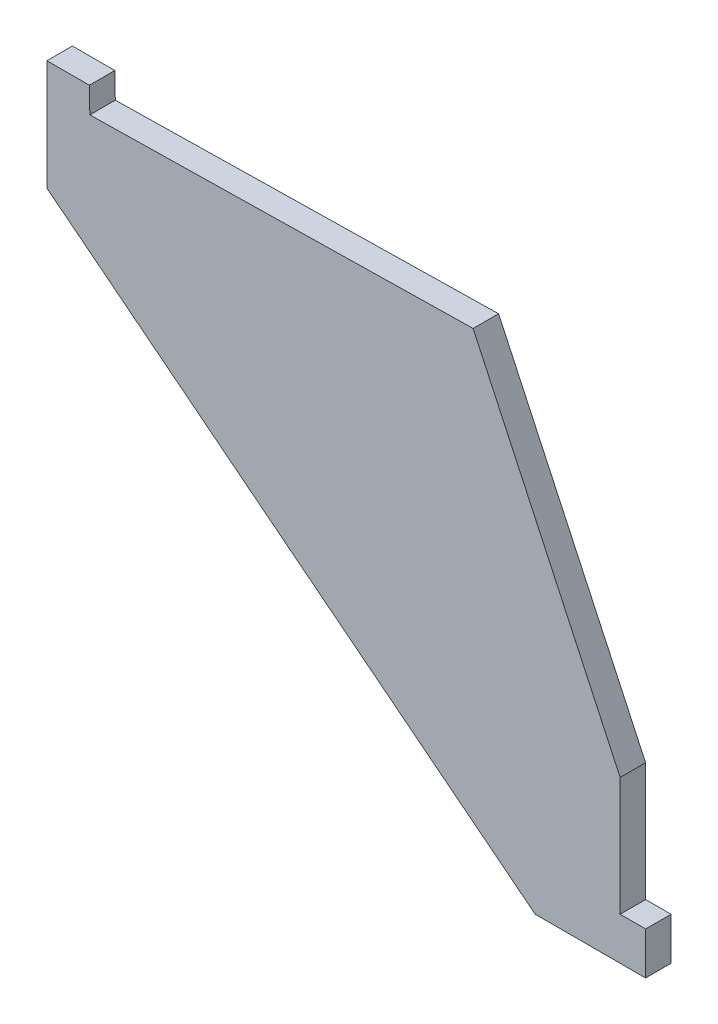
from build123d import *

# Parameters (mm, degrees)
BOSS_EXTRU_2_DEPTH = 6


with BuildPart() as part:
    # Esquisse1 → Boss.-Extru.2 (new body)
    with BuildSketch(Plane.XY):
        Polygon((-75.997019675, 82.37137181), (-75.997019675, 76.373199329), (-75.997019675, 56.373199329), (39.002980325, -34.21862819), (59.002980325, -34.21862819), (65.002980325, -34.21862819), (65.002980325, -24.21862819), (59.002980325, -24.21862819), (59.002980325, 3.69137181), (24.376153572, 77.948841417), (-65.892321185, 76.373199329), (-65.997019675, 82.37137181), align=None)
    extrude(amount=BOSS_EXTRU_2_DEPTH)


solid = part.part
